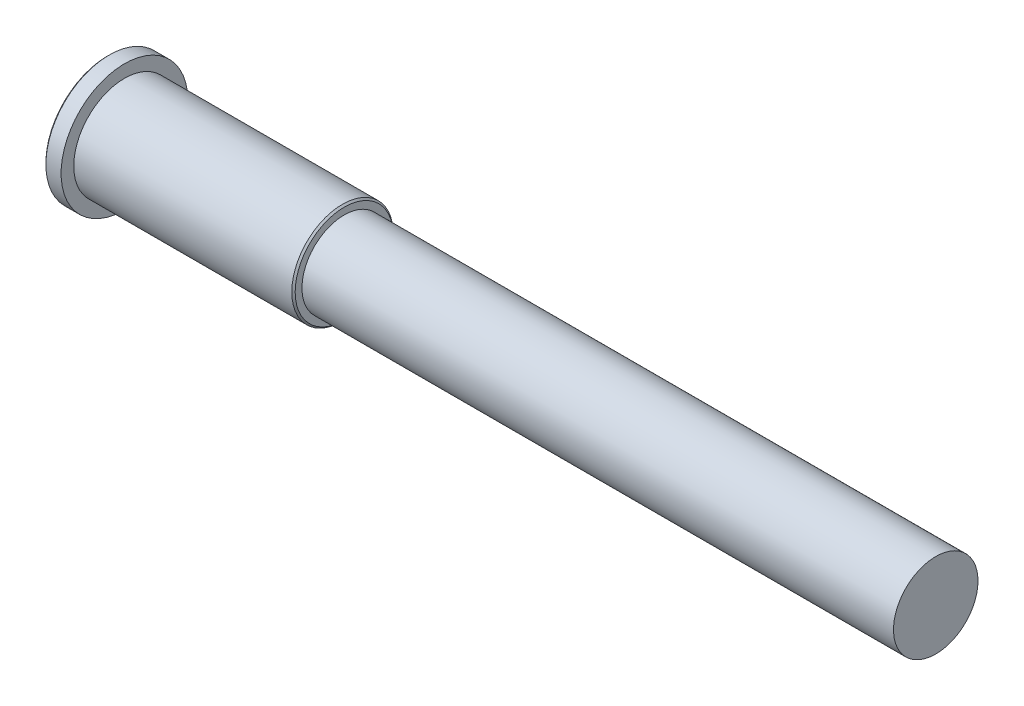
from build123d import *

# Parameters (mm, degrees)
SKETCH1_R           = 7.5
BOSS_EXTRUDE1_DEPTH = 2
SKETCH2_R           = 6
BOSS_EXTRUDE2_DEPTH = 26
SKETCH3_R           = 5
BOSS_EXTRUDE3_DEPTH = 70
CHAMFER1_SIZE       = 0.2
SCALE1_SCALE        = 0.317565217


with BuildPart() as part:
    # Sketch1 → Boss-Extrude1 (new body)
    with BuildSketch(Plane(origin=(0, 0, 0), x_dir=(0, 0, -1), z_dir=(1, 0, 0))):
        Circle(SKETCH1_R)
    extrude(amount=BOSS_EXTRUDE1_DEPTH)

    # Sketch2 → Boss-Extrude2 (add)
    with BuildSketch(Plane(origin=(2, 0, 0), x_dir=(0, 0, -1), z_dir=(1, 0, 0))):
        Circle(SKETCH2_R)
    extrude(amount=BOSS_EXTRUDE2_DEPTH)

    # Sketch3 → Boss-Extrude3 (add)
    with BuildSketch(Plane(origin=(28, 0, 0), x_dir=(0, 0, -1), z_dir=(1, 0, 0))):
        Circle(SKETCH3_R)
    extrude(amount=BOSS_EXTRUDE3_DEPTH)

    # Chamfer1
    chamfer1_edges = [part.edges().sort_by_distance(p)[0] for p in [
        (0, 0, 7.5),
        (28, 0, 6),
    ]]
    chamfer(chamfer1_edges, length=CHAMFER1_SIZE)


with BuildPart() as part_1:
    # Scale1: scaled about (44.459396685, 0, 0)
    add(part.part.scale(SCALE1_SCALE).moved(Location((30.340638712, 0, 0))))


solid = part_1.part
